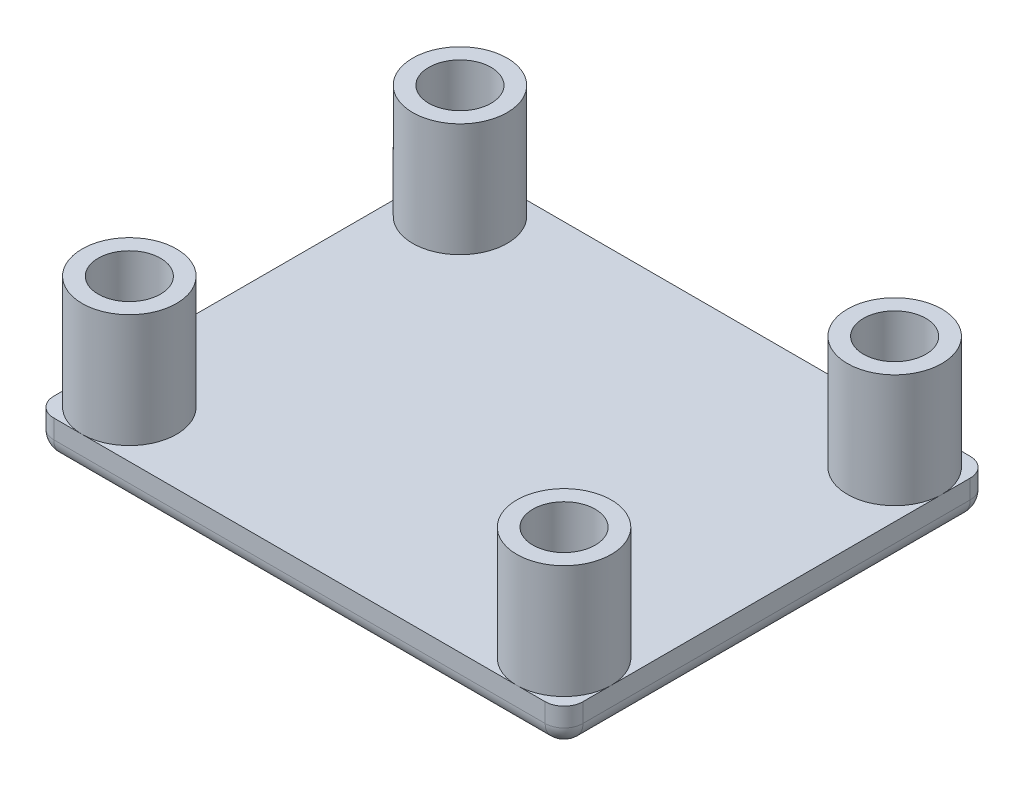
from build123d import *

# Parameters (mm, degrees)
CROQUIS1_W              = 28.01
CROQUIS1_H              = 22.5
SALIENTE_EXTRUIR1_DEPTH = 2
CROQUIS3_R              = 2.5
SALIENTE_EXTRUIR2_DEPTH = 6
CROQUIS4_R              = 1.65
CORTAR_EXTRUIR1_DEPTH   = 5
REDONDEO1_R             = 1
REDONDEO2_R             = 1


with BuildPart() as part:
    # Croquis1 → Saliente-Extruir1 (new body)
    with BuildSketch(Plane(origin=(0, 0, 0), x_dir=(1, 0, 0), z_dir=(0, 1, 0))):
        Rectangle(CROQUIS1_W, CROQUIS1_H)
    extrude(amount=SALIENTE_EXTRUIR1_DEPTH)

    # Croquis3 → Saliente-Extruir2 (add)
    with BuildSketch(Plane(origin=(0, 2, 0), x_dir=(1, 0, 0), z_dir=(0, 1, 0))):
        with Locations(Location((-11.505, 8.75, 0), (0, 0, 90))):
            Circle(CROQUIS3_R)
        with Locations(Location((11.505, 8.75, 0), (0, 0, 90))):
            Circle(CROQUIS3_R)
        with Locations(Location((11.505, -8.75, 0), (0, 0, 270))):
            Circle(CROQUIS3_R)
        with Locations(Location((-11.505, -8.75, 0), (0, 0, 270))):
            Circle(CROQUIS3_R)
    extrude(amount=SALIENTE_EXTRUIR2_DEPTH)

    # Croquis4 → Cortar-Extruir1 (cut)
    with BuildSketch(Plane(origin=(0, 8, 0), x_dir=(1, 0, 0), z_dir=(0, 1, 0))):
        with Locations(Location((-11.505, 8.75, 0), (0, 0, 270))):
            Circle(CROQUIS4_R)
        with Locations(Location((11.505, 8.75, 0), (0, 0, 270))):
            Circle(CROQUIS4_R)
        with Locations(Location((11.505, -8.75, 0), (0, 0, 270))):
            Circle(CROQUIS4_R)
        with Locations(Location((-11.505, -8.75, 0), (0, 0, 270))):
            Circle(CROQUIS4_R)
    extrude(amount=-CORTAR_EXTRUIR1_DEPTH, mode=Mode.SUBTRACT)

    # Redondeo1
    redondeo1_edges = [part.edges().sort_by_distance(p)[0] for p in [
        (0, 0, 11.25),
        (-14.005, 0, 0),
        (0, 0, -11.25),
        (14.005, 0, 0),
    ]]
    fillet(redondeo1_edges, radius=REDONDEO1_R)

    # Redondeo2
    # the kernel refuses this fillet: 1 mm, written as the material it takes off along each edge
    with BuildSketch(Plane(origin=(-13.005, 1, 10.25), x_dir=(-1, 0, 0), z_dir=(0, 0, 1))) as redondeo2_piece_1_section:
        Polygon((0, 0), (REDONDEO2_R, 0), (REDONDEO2_R, REDONDEO2_R), (0, REDONDEO2_R), align=None)
    redondeo2_piece_1 = extrude(amount=REDONDEO2_R, mode=Mode.PRIVATE)
    redondeo2_piece_1 = redondeo2_piece_1 - Plane(origin=(-13.005, 1, 10.25), x_dir=(0.7071067811865475, 0.7071067811865475, 0), z_dir=(0, 0, 1)) * Sphere(REDONDEO2_R, mode=Mode.PRIVATE)
    add(redondeo2_piece_1, mode=Mode.SUBTRACT)
    with BuildSketch(Plane(origin=(-13.005, 1, -10.25), x_dir=(0, 0, -1), z_dir=(-1, 0, 0))) as redondeo2_piece_2_section:
        Polygon((0, 0), (REDONDEO2_R, 0), (REDONDEO2_R, REDONDEO2_R), (0, REDONDEO2_R), align=None)
    redondeo2_piece_2 = extrude(amount=REDONDEO2_R, mode=Mode.PRIVATE)
    redondeo2_piece_2 = redondeo2_piece_2 - Plane(origin=(-13.005, 1, -10.25), x_dir=(0, 0.7071067811865475, 0.7071067811865475), z_dir=(-1, 0, 0)) * Sphere(REDONDEO2_R, mode=Mode.PRIVATE)
    add(redondeo2_piece_2, mode=Mode.SUBTRACT)
    with BuildSketch(Plane(origin=(13.005, 1, 10.25), x_dir=(1, 0, 0), z_dir=(0, 0, 1))) as redondeo2_piece_3_section:
        Polygon((0, 0), (REDONDEO2_R, 0), (REDONDEO2_R, -REDONDEO2_R), (0, -REDONDEO2_R), align=None)
    redondeo2_piece_3 = extrude(amount=REDONDEO2_R, mode=Mode.PRIVATE)
    redondeo2_piece_3 = redondeo2_piece_3 - Plane(origin=(13.005, 1, 10.25), x_dir=(-0.7071067811865475, 0.7071067811865475, 0), z_dir=(0, 0, 1)) * Sphere(REDONDEO2_R, mode=Mode.PRIVATE)
    add(redondeo2_piece_3, mode=Mode.SUBTRACT)
    with BuildSketch(Plane(origin=(13.005, 1, -10.25), x_dir=(0, 0, -1), z_dir=(1, 0, 0))) as redondeo2_piece_4_section:
        Polygon((0, 0), (REDONDEO2_R, 0), (REDONDEO2_R, -REDONDEO2_R), (0, -REDONDEO2_R), align=None)
    redondeo2_piece_4 = extrude(amount=REDONDEO2_R, mode=Mode.PRIVATE)
    redondeo2_piece_4 = redondeo2_piece_4 - Plane(origin=(13.005, 1, -10.25), x_dir=(0, 0.7071067811865475, 0.7071067811865475), z_dir=(1, 0, 0)) * Sphere(REDONDEO2_R, mode=Mode.PRIVATE)
    add(redondeo2_piece_4, mode=Mode.SUBTRACT)
    with BuildSketch(Plane(origin=(14.005, 1, 11.25), x_dir=(-1, 0, 0), z_dir=(0, 1, 0)), Plane(origin=(14.005, 1, -11.25), x_dir=(0, 0, 1), z_dir=(0, 1, 0))) as redondeo2_piece_5:
        with BuildLine():
            CenterArc((REDONDEO2_R, -REDONDEO2_R), REDONDEO2_R, 90, 90)
            Line((0, -REDONDEO2_R), (0, 0))
            Line((0, 0), (REDONDEO2_R, 0))
        make_face()
    extrude(amount=3.5, mode=Mode.SUBTRACT)
    with BuildSketch(Plane(origin=(-14.005, 1, 11.25), x_dir=(1, 0, 0), z_dir=(0, 1, 0)), Plane(origin=(-14.005, 1, -11.25), x_dir=(0, 0, 1), z_dir=(0, 1, 0))) as redondeo2_piece_6:
        with BuildLine():
            CenterArc((REDONDEO2_R, REDONDEO2_R), REDONDEO2_R, 180, 90)
            Line((0, REDONDEO2_R), (0, 0))
            Line((0, 0), (REDONDEO2_R, 0))
        make_face()
    extrude(amount=3.5, mode=Mode.SUBTRACT)


solid = part.part
